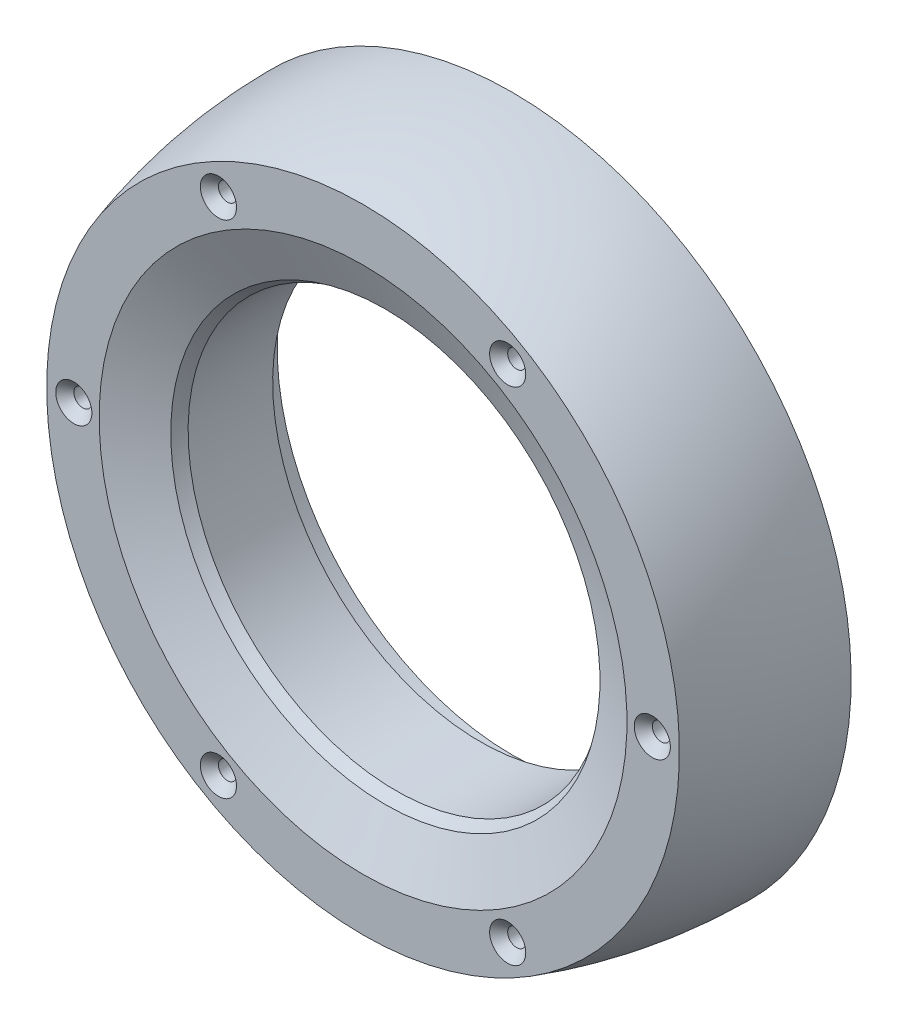
from build123d import *

# Parameters (mm, degrees)
FASE1_SIZE             = 4.290340475
M2_SENKUNG_D           = 2
M2_SENKUNG_CSINK_D     = 4
M2_SENKUNG_CSINK_ANGLE = 90


with BuildPart() as part:
    # Skizze1 → Rotation (revolve)
    with BuildSketch(Plane(origin=(0, 0, 0), x_dir=(0, 0, -1), z_dir=(1, 0, 0))):
        with BuildLine():
            Line((0, 26), (0, 37.5))
            ThreePointArc((0, 37.5), (-8.344159634, 36.871453585), (-16.5, 35))
            Line((-16.5, 35), (-16.5, 24.905973721))
            ThreePointArc((-16.5, 24.905973721), (-14.620334002, 24.063560793), (-12.856349239, 23))
            Line((-12.856349239, 23), (-3.5, 23))
            Line((-3.5, 23), (-3.5, 26))
            Line((-3.5, 26), (0, 26))
        make_face()
    revolve(axis=Axis((0, 0, -11.01172812), (0, 0, 1)))

    # Fase1
    # the kernel refuses this chamfer: 4.290340475, 2.5 mm, written as the material it takes off along each edge
    with BuildSketch(Plane(origin=(0, 0, 16.5), x_dir=(0, 1, 0), z_dir=(1, 0, 0))) as fase1_piece_1:
        with BuildLine():
            Line((24.905973721 + FASE1_SIZE, 0), (23.741652955, -2.466620822))
            ThreePointArc((23.741652955, -2.466620822), (24.345172312, -1.316125117), (24.905973721, 0))
            Line((24.905973721, 0), (24.905973721 + FASE1_SIZE, 0))
        make_face()
    revolve(axis=Axis((0, 0, 16.5), (0, 0, 1)), mode=Mode.SUBTRACT)

    # M2 Senkung (through all)
    with Locations(Plane.XY.offset(16.5)):
        with Locations((-16, 27.712812921), (16, 27.712812921), (32, 0), (16, -27.712812921), (-16, -27.712812921), (-32, 0)):
            CounterSinkHole(M2_SENKUNG_D / 2, M2_SENKUNG_CSINK_D / 2, counter_sink_angle=M2_SENKUNG_CSINK_ANGLE)


solid = part.part
